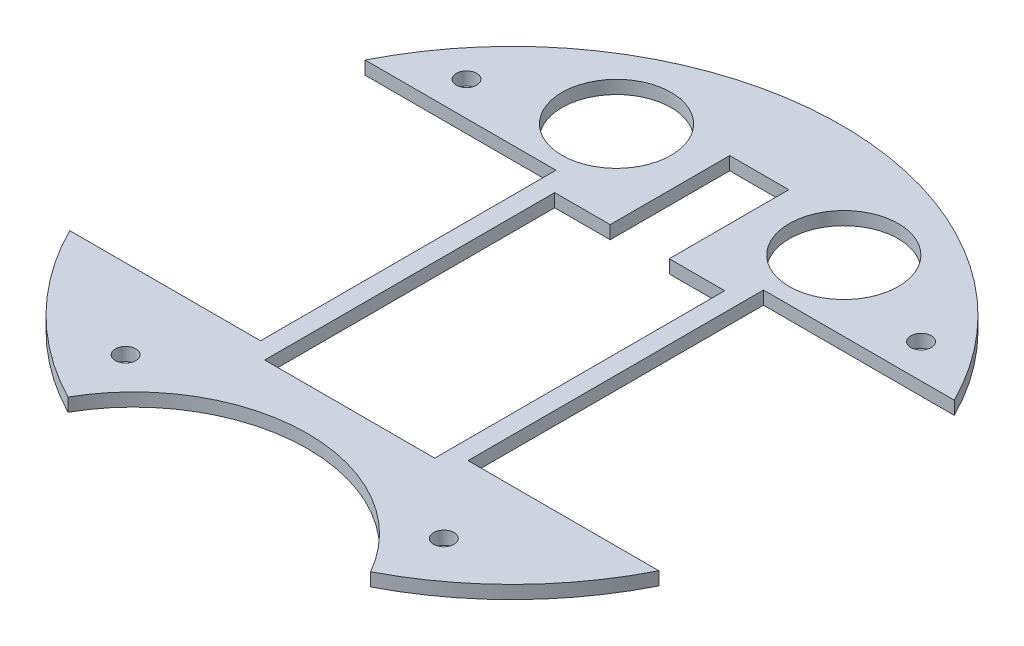
from build123d import *

# Parameters (mm, degrees)
BOSS_EXTRUDE1_DEPTH  = 2.9
SOLENOID_PLACEMENT_W = 37.4
SOLENOID_PLACEMENT_H = 63.8
CUT_EXTRUDE1_DEPTH   = 103.571487266
CUT_EXTRUDE3_DEPTH   = 103.571487266
SKETCH4_W            = 13
SKETCH4_H            = 26.3
CUT_EXTRUDE4_DEPTH   = 98.286484159
SKETCH5_R            = 12
CUT_EXTRUDE5_DEPTH   = 98.286484159
SKETCH6_R            = 2.25
CUT_EXTRUDE6_DEPTH   = 98.286484159


with BuildPart() as part:
    # Sketch1 → Boss-Extrude1 (new body)
    with BuildSketch(Plane(origin=(0, 0, 0), x_dir=(1, 0, 0), z_dir=(0, 1, 0))):
        with BuildLine():
            ThreePointArc((33.29110537, -64.404598464), (0, 72.5), (-33.29110537, -64.404598464))
            ThreePointArc((-33.29110537, -64.404598464), (0, -44.989799638), (33.29110537, -64.404598464))
        make_face()
    extrude(amount=BOSS_EXTRUDE1_DEPTH)

    # solenoid placement → Cut-Extrude1 (cut, through all)
    with BuildSketch(Plane(origin=(0, 2.9, 0), x_dir=(1, 0, 0), z_dir=(0, 1, 0))):
        with Locations((0, -3.8)):
            Rectangle(SOLENOID_PLACEMENT_W, SOLENOID_PLACEMENT_H)
    extrude(amount=-CUT_EXTRUDE1_DEPTH, mode=Mode.SUBTRACT)

    # Sketch3 → Cut-Extrude3 (cut, through all)
    with BuildSketch(Plane(origin=(0, 2.9, 0), x_dir=(1, 0, 0), z_dir=(0, 1, 0))):
        with BuildLine():
            Line((-34.63, -32.5), (-22.83, -32.5))
            Line((-22.83, -32.5), (-22.83, 32.5))
            Line((-22.83, 32.5), (-64.807406984, 32.5))
            ThreePointArc((-64.807406984, 32.5), (-72.5, 0), (-64.807406984, -32.5))
            Line((-64.807406984, -32.5), (-34.63, -32.5))
        make_face()
        with BuildLine():
            Line((34.63, -32.5), (64.807406984, -32.5))
            ThreePointArc((64.807406984, -32.5), (72.5, 0), (64.807406984, 32.5))
            Line((64.807406984, 32.5), (22.83, 32.5))
            Line((22.83, 32.5), (22.83, -32.5))
            Line((22.83, -32.5), (34.63, -32.5))
        make_face()
    extrude(amount=-CUT_EXTRUDE3_DEPTH, mode=Mode.SUBTRACT)

    # Sketch4 → Cut-Extrude4 (cut, through all)
    with BuildSketch(Plane(origin=(0, 2.9, 0), x_dir=(1, 0, 0), z_dir=(0, 1, 0))):
        with Locations((0, 41.25)):
            Rectangle(SKETCH4_W, SKETCH4_H)
    extrude(amount=-CUT_EXTRUDE4_DEPTH, mode=Mode.SUBTRACT)

    # Sketch5 → Cut-Extrude5 (cut, through all)
    with BuildSketch(Plane(origin=(0, 2.9, 0), x_dir=(1, 0, 0), z_dir=(0, 1, 0))):
        with Locations((-25, 48)):
            Circle(SKETCH5_R)
        with Locations((25, 48)):
            Circle(SKETCH5_R)
    extrude(amount=-CUT_EXTRUDE5_DEPTH, mode=Mode.SUBTRACT)

    # Sketch6 → Cut-Extrude6 (cut, through all)
    with BuildSketch(Plane(origin=(0, 2.9, 0), x_dir=(1, 0, 0), z_dir=(0, 1, 0))):
        with Locations((35, -50)):
            Circle(SKETCH6_R)
        with Locations((-35, -50)):
            Circle(SKETCH6_R)
        with Locations((-50, 40)):
            Circle(SKETCH6_R)
        with Locations((50, 40)):
            Circle(SKETCH6_R)
    extrude(amount=-CUT_EXTRUDE6_DEPTH, mode=Mode.SUBTRACT)


solid = part.part
